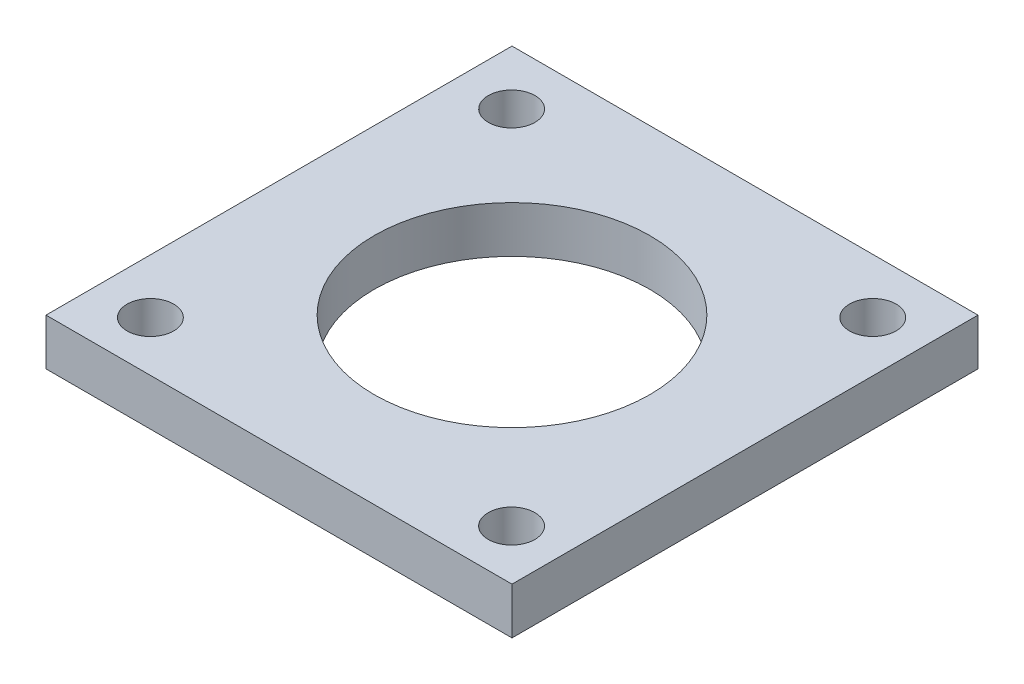
from build123d import *

# Parameters (mm, degrees)
SKETCH1_W           = 40
SKETCH1_H           = 40
SKETCH1_R           = 11.82922145
SKETCH1_R_2         = 1.999999076
BOSS_EXTRUDE1_DEPTH = 4


with BuildPart() as part:
    # Sketch1 → Boss-Extrude1 (new body)
    with BuildSketch(Plane(origin=(0, 0, 0), x_dir=(1, 0, 0), z_dir=(0, 1, 0))):
        with Locations((-0.055147057, 0.947228794)):
            Rectangle(SKETCH1_W, SKETCH1_H)
        with Locations((-0.055147057, 0.947228794)):
            Circle(SKETCH1_R, mode=Mode.SUBTRACT)
        with Locations((-15.393266989, 16.254586215)):
            Circle(SKETCH1_R_2, mode=Mode.SUBTRACT)
        with Locations((15.606731446, 16.254585764)):
            Circle(SKETCH1_R_2, mode=Mode.SUBTRACT)
        with Locations((-15.393268838, -14.752771206)):
            Circle(SKETCH1_R_2, mode=Mode.SUBTRACT)
        with Locations((15.607689771, -14.752898519)):
            Circle(SKETCH1_R_2, mode=Mode.SUBTRACT)
    extrude(amount=BOSS_EXTRUDE1_DEPTH)


solid = part.part
